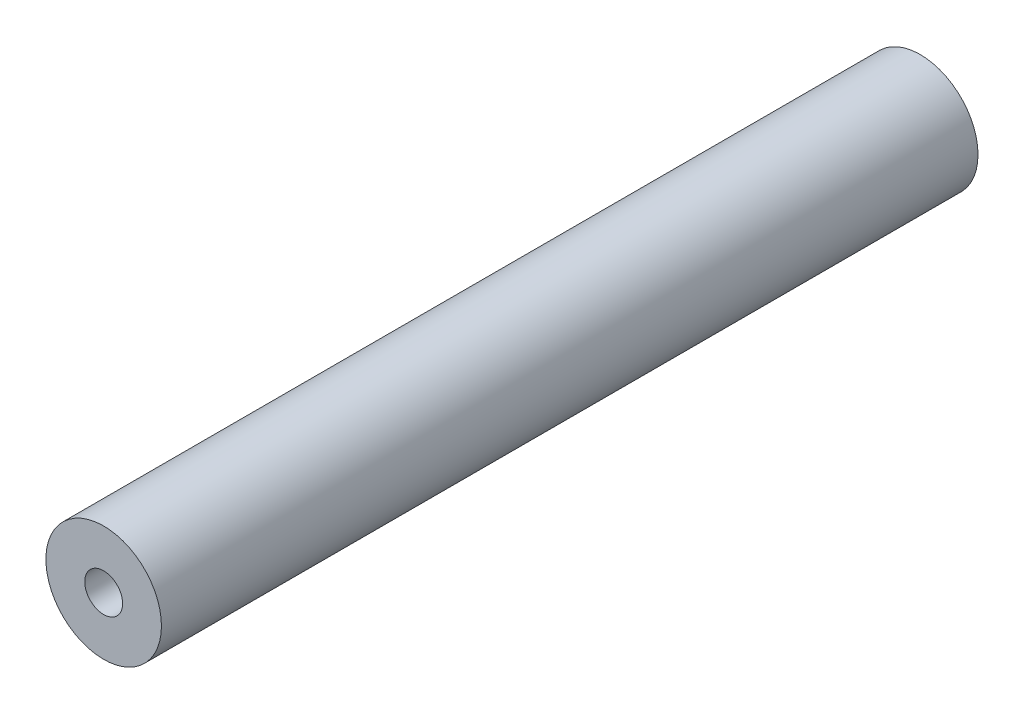
from build123d import *

# Parameters (mm, degrees)
SKETCH1_R           = 7.5
BOSS_EXTRUDE1_DEPTH = 53
SKETCH2_R           = 2.46
CUT_EXTRUDE1_DEPTH  = 15


with BuildPart() as part:
    # Sketch1 → Boss-Extrude1 (new, symmetric)
    with BuildSketch(Plane.XY):
        Circle(SKETCH1_R)
    extrude(amount=BOSS_EXTRUDE1_DEPTH, both=True)

    # Sketch2 → Cut-Extrude1 (cut)
    with BuildSketch(Plane.XY.offset(53)):
        Circle(SKETCH2_R)
    cut_extrude1 = extrude(amount=-CUT_EXTRUDE1_DEPTH, mode=Mode.SUBTRACT)

    # Mirror1: Cut-Extrude1 across plane
    add(cut_extrude1.mirror(Plane.XY), mode=Mode.SUBTRACT)


solid = part.part
